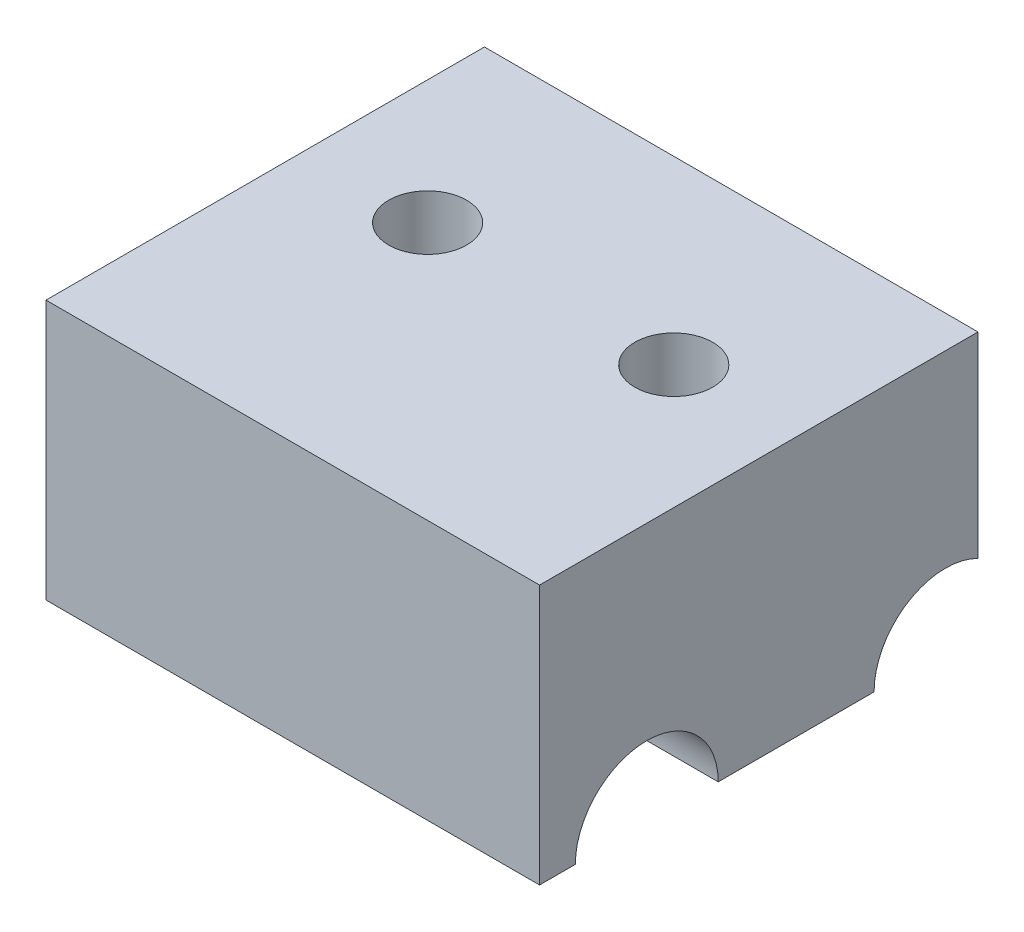
from build123d import *

# Parameters (mm, degrees)
REVOLVE1_ANGLE           = 180
BOSS_EXTRUDE1_DEPTH      = 9.25
BOSS_EXTRUDE1_DEPTH_BACK = 9.25
BOSS_EXTRUDE2_START      = 3.5
BOSS_EXTRUDE2_DEPTH      = 5.75
BOSS_EXTRUDE3_START      = -3.5
BOSS_EXTRUDE3_DEPTH      = 5.75
SKETCH14_W               = 2.5
SKETCH14_H               = 5
CUT_EXTRUDE10_DEPTH      = 22.715489863
SKETCH13_W               = 5.5
SKETCH13_H               = 2.75
CUT_EXTRUDE9_DEPTH       = 1.75
SKETCH15_W               = 19
SKETCH15_H               = 8
CUT_EXTRUDE11_DEPTH      = 29.575557737
SKETCH16_W               = 5.122625222
SKETCH16_H               = 5
CUT_EXTRUDE12_DEPTH      = 24.421411145
SKETCH17_W               = 19
SKETCH17_H               = 16.877374778
BOSS_EXTRUDE4_DEPTH      = 5
SKETCH18_R               = 1.5
CUT_EXTRUDE13_DEPTH      = 25.97123345


with BuildPart() as part:
    # Sketch6 → Revolve1 (revolve)
    with BuildSketch(Plane(origin=(0, 0, 0), x_dir=(1, 0, 0), z_dir=(0, 1, 0))):
        Polygon((0, 5), (0, 2.75), (8, 2.75), (8, 2.25), (9, 2.75), (15, 2.75), (15, 2.25), (16, 2.75), (19, 2.75), (19, 5), align=None)
    revolve(axis=Axis((0, 0, 0), (1, 0, 0)), revolution_arc=REVOLVE1_ANGLE)

    # Sketch9 → Boss-Extrude1 (add, two sides: drawn at the far end of the back side and taken through both)
    with BuildSketch(Plane.XY.offset(-BOSS_EXTRUDE1_DEPTH_BACK)):
        Polygon((0, 5), (0, 3.25), (19, 2.75), (19, 5), align=None)
    extrude(amount=BOSS_EXTRUDE1_DEPTH + BOSS_EXTRUDE1_DEPTH_BACK)

    # Sketch9<3> → Boss-Extrude2 (add)
    with BuildSketch(Plane.XY.offset(BOSS_EXTRUDE2_START)):
        Polygon((0, 3.25), (0, 0), (19, 0), (19, 2.75), align=None)
    extrude(amount=BOSS_EXTRUDE2_DEPTH)

    # Sketch9<4> → Boss-Extrude3 (add)
    with BuildSketch(Plane.XY.offset(BOSS_EXTRUDE3_START)):
        Polygon((0, 3.25), (0, 0), (19, 0), (19, 2.75), align=None)
    extrude(amount=-BOSS_EXTRUDE3_DEPTH)

    # Sketch14 → Cut-Extrude10 (cut, through all)
    with BuildSketch(Plane.ZY):
        with Locations((-8, 2.5)):
            Rectangle(SKETCH14_W, SKETCH14_H)
    extrude(amount=-CUT_EXTRUDE10_DEPTH, mode=Mode.SUBTRACT)

    # Mirror4: part across plane


with BuildPart() as part_1:
    add(part.part)
    add(part.part.mirror(Plane.XY.offset(-5.75)))

    # Sketch13 → Cut-Extrude9 (cut)
    with BuildSketch(Plane.ZY):
        with Locations((0, 1.375)):
            Rectangle(SKETCH13_W, SKETCH13_H)
    extrude(amount=-CUT_EXTRUDE9_DEPTH, mode=Mode.SUBTRACT)

    # Sketch15 → Cut-Extrude11 (cut, through all)
    with BuildSketch(Plane(origin=(0, 5, 0), x_dir=(1, 0, 0), z_dir=(0, 1, 0))):
        with Locations((9.5, 16.75)):
            Rectangle(SKETCH15_W, SKETCH15_H)
    extrude(amount=-CUT_EXTRUDE11_DEPTH, mode=Mode.SUBTRACT)

    # Sketch16 → Cut-Extrude12 (cut, through all)
    with BuildSketch(Plane.ZY):
        with Locations((6.688687389, 2.5)):
            Rectangle(SKETCH16_W, SKETCH16_H)
    extrude(amount=-CUT_EXTRUDE12_DEPTH, mode=Mode.SUBTRACT)

    # Sketch17 → Boss-Extrude4 (add)
    with BuildSketch(Plane(origin=(0, 5, 0), x_dir=(1, 0, 0), z_dir=(0, 1, 0))):
        with Locations((9.5, 4.311312611)):
            Rectangle(SKETCH17_W, SKETCH17_H)
    extrude(amount=BOSS_EXTRUDE4_DEPTH)

    # Sketch18 → Cut-Extrude13 (cut, through all)
    with BuildSketch(Plane(origin=(0, 10, 0), x_dir=(1, 0, 0), z_dir=(0, 1, 0))):
        with Locations((4.7625, 5.800842989)):
            Circle(SKETCH18_R)
        with Locations((14.2375, 5.800842989)):
            Circle(SKETCH18_R)
    extrude(amount=-CUT_EXTRUDE13_DEPTH, mode=Mode.SUBTRACT)


solid = part_1.part
